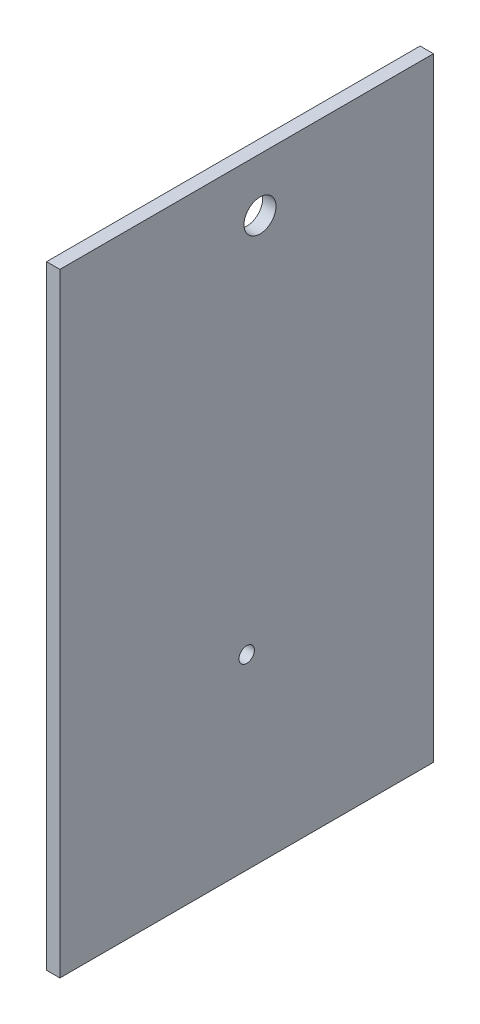
from build123d import *

# Parameters (mm, degrees)
SKETCH1_W           = 88.9
SKETCH1_H           = 146.05
BOSS_EXTRUDE1_DEPTH = 3.175
SKETCH2_R           = 3.81
CUT_EXTRUDE1_DEPTH  = 86.548429267
SKETCH3_R           = 1.8288
CUT_EXTRUDE2_DEPTH  = 86.548429267


with BuildPart() as part:
    # Sketch1 → Boss-Extrude1 (new body)
    with BuildSketch(Plane(origin=(0, 0, 0), x_dir=(0, 0, -1), z_dir=(1, 0, 0))):
        Rectangle(SKETCH1_W, SKETCH1_H)
    extrude(amount=BOSS_EXTRUDE1_DEPTH)

    # Sketch2 → Cut-Extrude1 (cut, through all)
    with BuildSketch(Plane(origin=(3.175, 0, 0), x_dir=(0, 0, -1), z_dir=(1, 0, 0))):
        with Locations((3.175, 60.325)):
            Circle(SKETCH2_R)
    extrude(amount=-CUT_EXTRUDE1_DEPTH, mode=Mode.SUBTRACT)

    # Sketch3 → Cut-Extrude2 (cut, through all)
    with BuildSketch(Plane.ZY):
        with Locations((0, -28.575)):
            Circle(SKETCH3_R)
    extrude(amount=-CUT_EXTRUDE2_DEPTH, mode=Mode.SUBTRACT)


solid = part.part
